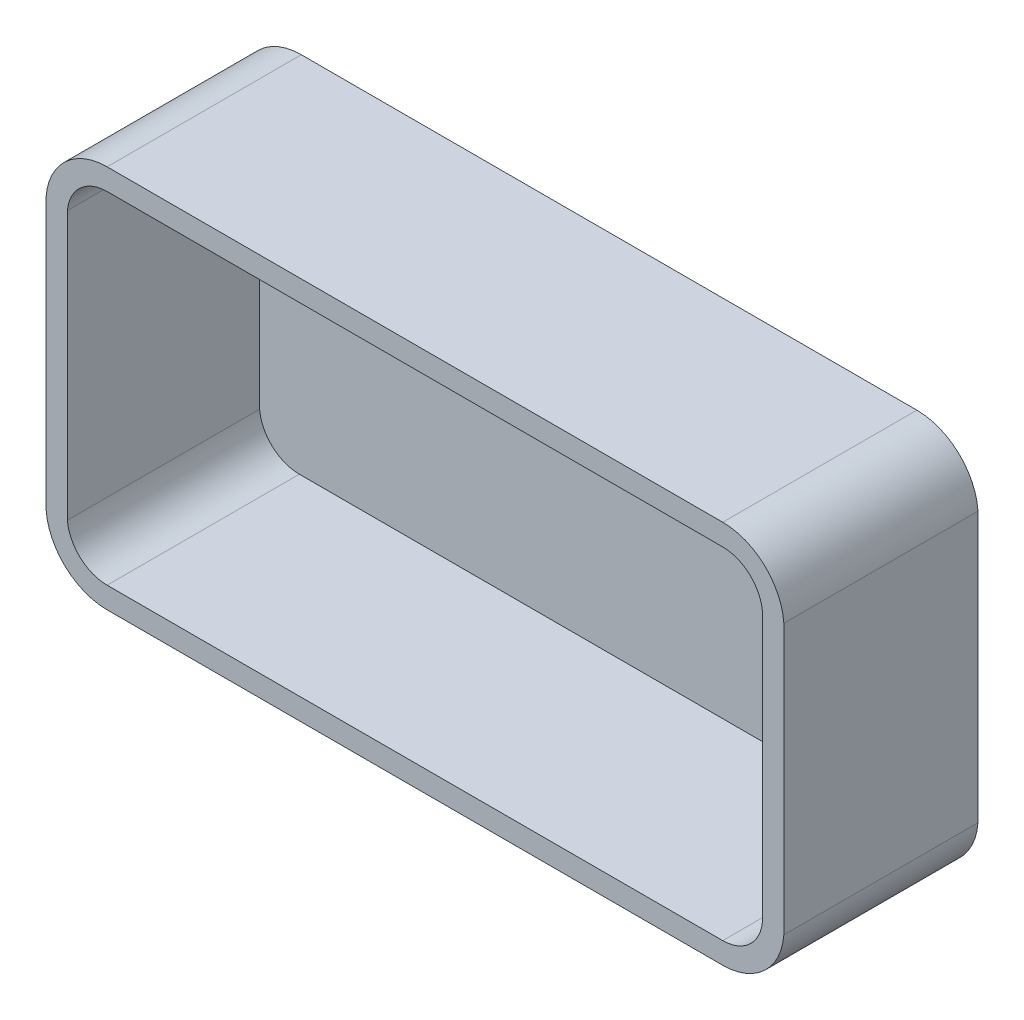
from build123d import *

# Parameters (mm, degrees)
BOSS_EXTRUDE2_DEPTH = 1000
BOSS_EXTRUDE3_DEPTH = 10


with BuildPart() as part:
    # Sketch1<6> → Boss-Extrude2 (new body)
    with BuildSketch(Plane.XY):
        with BuildLine():
            Line((5219.30963149, 1976), (8389.704370421, 1976))
            ThreePointArc((8389.704370421, 1976), (8604.800493219, 1891.347594916), (8704.507000955, 1682.802673989))
            Line((8704.507000955, 1682.802673989), (8704.507000955, 293.197326011))
            ThreePointArc((8704.507000955, 293.197326011), (8604.800493219, 84.652405084), (8389.704370421, 0))
            Line((8389.704370421, 0), (5219.30963149, 0))
            ThreePointArc((5219.30963149, 0), (5004.213508692, 84.652405084), (4904.507000955, 293.197326011))
            Line((4904.507000955, 293.197326011), (4904.507000955, 1682.802673989))
            ThreePointArc((4904.507000955, 1682.802673989), (5004.213508692, 1891.347594916), (5219.30963149, 1976))
        make_face()
        with BuildLine():
            Line((5219.30963149, 110), (8389.704370421, 110))
            ThreePointArc((8389.704370421, 110), (8528.547244904, 163.962696181), (8594.507000955, 297.524019008))
            Line((8594.507000955, 297.524019008), (8594.507000955, 1678.475980992))
            ThreePointArc((8594.507000955, 1678.475980992), (8528.547244904, 1812.037303819), (8389.704370421, 1866))
            Line((8389.704370421, 1866), (5219.30963149, 1866))
            ThreePointArc((5219.30963149, 1866), (5080.466757007, 1812.037303819), (5014.507000955, 1678.475980992))
            Line((5014.507000955, 1678.475980992), (5014.507000955, 297.524019008))
            ThreePointArc((5014.507000955, 297.524019008), (5080.466757007, 163.962696181), (5219.30963149, 110))
        make_face(mode=Mode.SUBTRACT)
    extrude(amount=BOSS_EXTRUDE2_DEPTH)

    # Sketch6 → Boss-Extrude3 (add)
    with BuildSketch(Plane.XY):
        with BuildLine():
            Line((5219.30963149, 0), (8389.704370421, 0))
            ThreePointArc((8389.704370421, 0), (8604.800493219, 84.652405084), (8704.507000955, 293.197326011))
            Line((8704.507000955, 293.197326011), (8704.507000955, 1682.802673989))
            ThreePointArc((8704.507000955, 1682.802673989), (8604.800493219, 1891.347594916), (8389.704370421, 1976))
            Line((8389.704370421, 1976), (5219.30963149, 1976))
            ThreePointArc((5219.30963149, 1976), (5004.213508692, 1891.347594916), (4904.507000955, 1682.802673989))
            Line((4904.507000955, 1682.802673989), (4904.507000955, 293.197326011))
            ThreePointArc((4904.507000955, 293.197326011), (5004.213508692, 84.652405084), (5219.30963149, 0))
        make_face()
    extrude(amount=BOSS_EXTRUDE3_DEPTH)


solid = part.part
